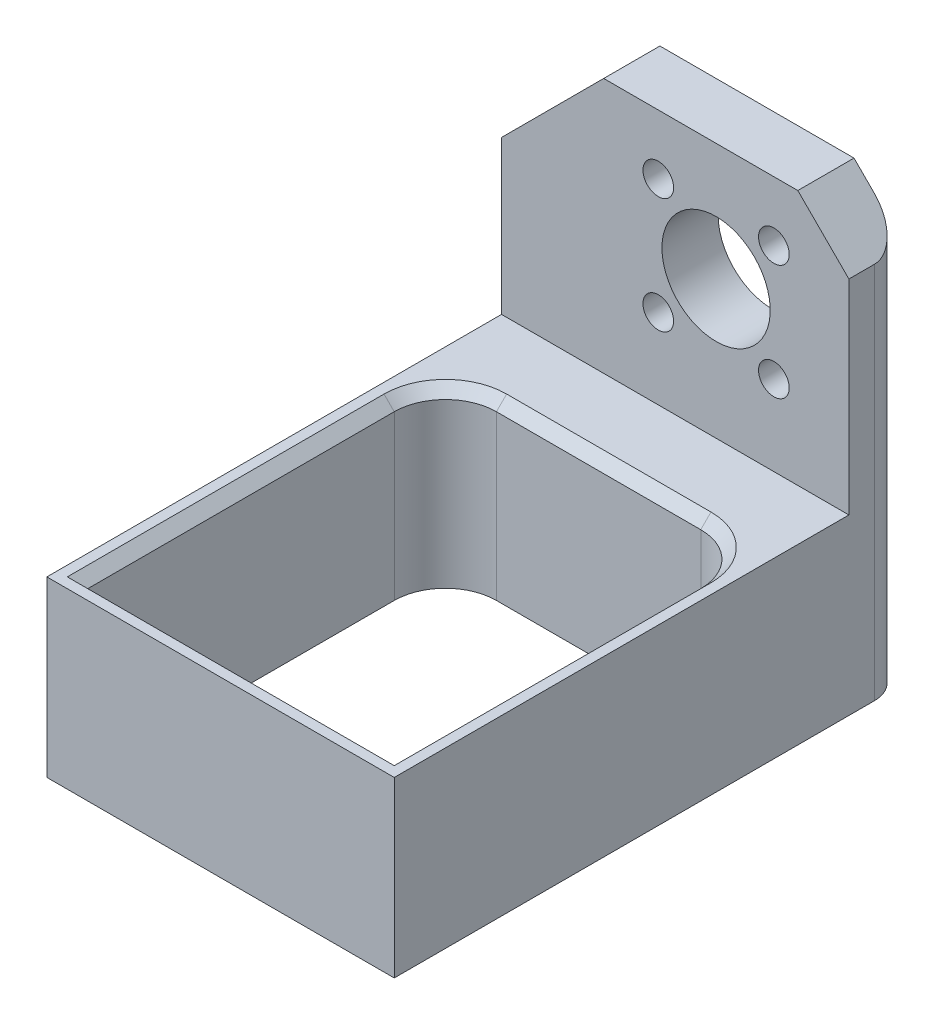
from build123d import *

# Parameters (mm, degrees)
SZKIC1_W                    = 34
SZKIC1_H                    = 50
DODANIE_WYCI_GNI_CIE1_DEPTH = 17
SZKIC2_W                    = 30
SZKIC2_H                    = 30
WYTNIJ_WYCI_GNI_CIE1_DEPTH  = 20
SZKIC3_W                    = 34
SZKIC3_H                    = 5.5
DODANIE_WYCI_GNI_CIE2_DEPTH = 25
SZKIC4_R                    = 1.5
SZKIC4_R_2                  = 5.3
WYTNIJ_WYCI_GNI_CIE2_DEPTH  = 25
SFAZOWANIE1_SIZE            = 10
SFAZOWANIE2_SIZE            = 5
ZAOKR_GLENIE1_R             = 3
SZKIC5_W                    = 30
SZKIC5_H                    = 17
WYTNIJ_WYCI_GNI_CIE3_DEPTH  = 5
ZAOKR_GLENIE2_R             = 5
SFAZOWANIE3_SIZE            = 1


with BuildPart() as part:
    # Szkic1 → Dodanie-wyciągnięcie1 (new body)
    with BuildSketch(Plane(origin=(0, 0, 0), x_dir=(1, 0, 0), z_dir=(0, 1, 0))):
        Rectangle(SZKIC1_W, SZKIC1_H)
    extrude(amount=DODANIE_WYCI_GNI_CIE1_DEPTH)

    # Szkic2 → Wytnij-wyciągnięcie1 (cut)
    with BuildSketch(Plane(origin=(0, 17, 0), x_dir=(1, 0, 0), z_dir=(0, 1, 0))):
        with Locations((0, -8)):
            Rectangle(SZKIC2_W, SZKIC2_H)
    extrude(amount=-WYTNIJ_WYCI_GNI_CIE1_DEPTH, mode=Mode.SUBTRACT)

    # Szkic3 → Dodanie-wyciągnięcie2 (add)
    with BuildSketch(Plane(origin=(0, 17, 0), x_dir=(1, 0, 0), z_dir=(0, 1, 0))):
        with Locations((0, 22.25)):
            Rectangle(SZKIC3_W, SZKIC3_H)
    extrude(amount=DODANIE_WYCI_GNI_CIE2_DEPTH)

    # Szkic4 → Wytnij-wyciągnięcie2 (cut)
    with BuildSketch(Plane(origin=(0, 0, -25), x_dir=(-1, 0, 0), z_dir=(0, 0, -1))):
        with Locations((1.656854249, 36.156854249)):
            Circle(SZKIC4_R)
        with Locations((-9.656854249, 36.156854249)):
            Circle(SZKIC4_R)
        with Locations((1.656854249, 24.843145751)):
            Circle(SZKIC4_R)
        with Locations((-9.656854249, 24.843145751)):
            Circle(SZKIC4_R)
        with Locations((-4, 30.5)):
            Circle(SZKIC4_R_2)
    extrude(amount=-WYTNIJ_WYCI_GNI_CIE2_DEPTH, mode=Mode.SUBTRACT)

    # Sfazowanie1
    sfazowanie1_edges = [part.edges().sort_by_distance(p)[0] for p in [
        (-17, 42, -22.25),
    ]]
    chamfer(sfazowanie1_edges, length=SFAZOWANIE1_SIZE)

    # Sfazowanie2
    sfazowanie2_edges = [part.edges().sort_by_distance(p)[0] for p in [
        (17, 42, -22.25),
    ]]
    chamfer(sfazowanie2_edges, length=SFAZOWANIE2_SIZE)

    # Zaokrąglenie1
    zaokr_glenie1_edges = [part.edges().sort_by_distance(p)[0] for p in [
        (17, 18.5, -25),
        (-17, 16, -25),
    ]]
    fillet(zaokr_glenie1_edges, radius=ZAOKR_GLENIE1_R)

    # Szkic5 → Wytnij-wyciągnięcie3 (cut)
    with BuildSketch(Plane.XY.offset(-7)):
        with Locations((0, 8.5)):
            Rectangle(SZKIC5_W, SZKIC5_H)
    extrude(amount=-WYTNIJ_WYCI_GNI_CIE3_DEPTH, mode=Mode.SUBTRACT)

    # Zaokrąglenie2
    zaokr_glenie2_edges = [part.edges().sort_by_distance(p)[0] for p in [
        (15, 8.5, -12),
        (-15, 8.5, -12),
    ]]
    fillet(zaokr_glenie2_edges, radius=ZAOKR_GLENIE2_R)

    # Sfazowanie3
    sfazowanie3_edges = [part.edges().sort_by_distance(p)[0] for p in [
        (13.535533906, 17, -10.535533906),
        (-13.535533906, 17, -10.535533906),
        (15, 17, 8),
        (0, 17, 23),
        (-15, 17, 8),
        (0, 17, -12),
    ]]
    chamfer(sfazowanie3_edges, length=SFAZOWANIE3_SIZE)


solid = part.part
